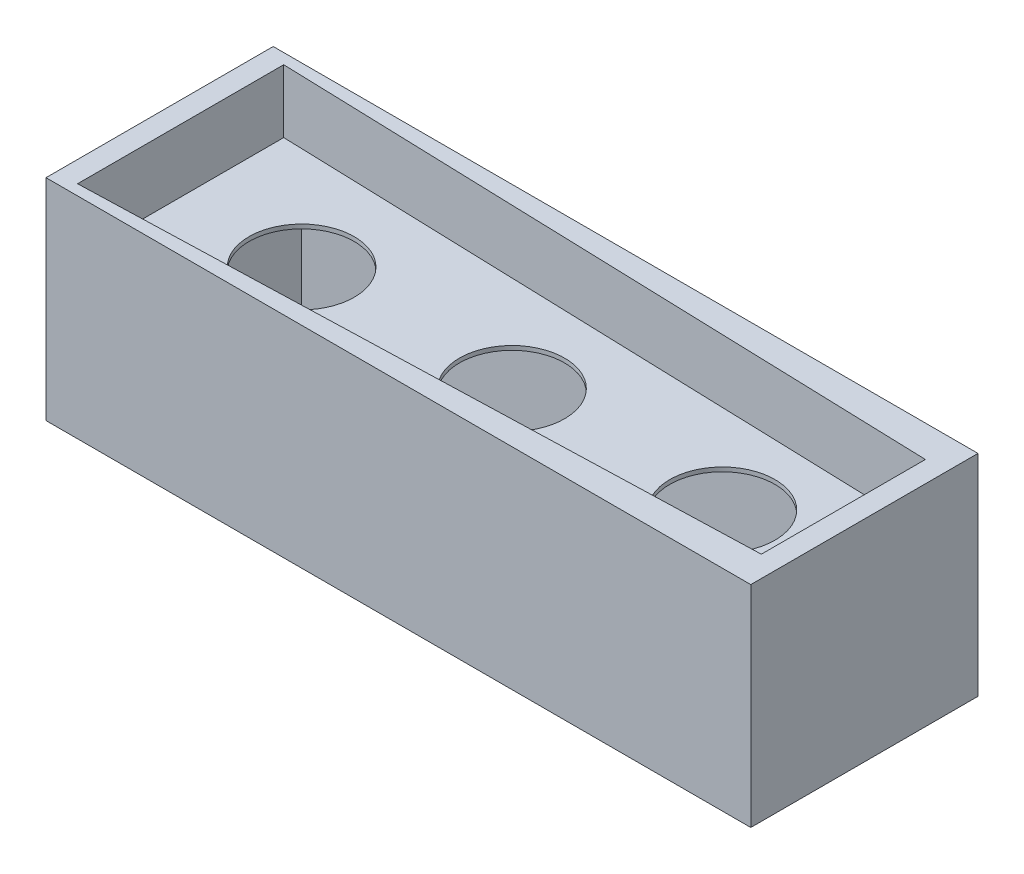
from build123d import *

# Parameters (mm, degrees)
SKETCH2_W           = 335
SKETCH2_H           = 108
BOSS_EXTRUDE4_DEPTH = 100
CUT_EXTRUDE1_DEPTH  = 30
SKETCH4_W           = 300
SKETCH4_H           = 100
CUT_EXTRUDE2_DEPTH  = 68
SKETCH7_R           = 25
CUT_EXTRUDE6_DEPTH  = 61
SKETCH8_R           = 25
CUT_EXTRUDE7_DEPTH  = 61
SKETCH9_R           = 25
CUT_EXTRUDE8_DEPTH  = 62


with BuildPart() as part:
    # Sketch2 → Boss-Extrude4 (new body)
    with BuildSketch(Plane(origin=(0, 0, 0), x_dir=(1, 0, 0), z_dir=(0, 1, 0))):
        Rectangle(SKETCH2_W, SKETCH2_H)
    extrude(amount=-BOSS_EXTRUDE4_DEPTH)

    # Sketch3 → Cut-Extrude1 (cut)
    with BuildSketch(Plane(origin=(0, 0, 0), x_dir=(1, 0, 0), z_dir=(0, 1, 0))):
        Polygon((-157.5, -49), (-157.5, 49), (157.5, 39), (157.5, -39), align=None)
    extrude(amount=-CUT_EXTRUDE1_DEPTH, mode=Mode.SUBTRACT)

    # Sketch4 → Cut-Extrude2 (cut)
    with BuildSketch(Plane(origin=(0, -100, 0), x_dir=(-1, 0, 0), z_dir=(0, -1, 0))):
        Rectangle(SKETCH4_W, SKETCH4_H)
    extrude(amount=-CUT_EXTRUDE2_DEPTH, mode=Mode.SUBTRACT)

    # Sketch7 → Cut-Extrude6 (cut)
    with BuildSketch(Plane(origin=(0, -30, 0), x_dir=(1, 0, 0), z_dir=(0, 1, 0))):
        with Locations((-100, 0)):
            Circle(SKETCH7_R)
    extrude(amount=-CUT_EXTRUDE6_DEPTH, mode=Mode.SUBTRACT)

    # Sketch8 → Cut-Extrude7 (cut)
    with BuildSketch(Plane(origin=(0, -30, 0), x_dir=(1, 0, 0), z_dir=(0, 1, 0))):
        Circle(SKETCH8_R)
    extrude(amount=-CUT_EXTRUDE7_DEPTH, mode=Mode.SUBTRACT)

    # Sketch9 → Cut-Extrude8 (cut)
    with BuildSketch(Plane(origin=(0, -30, 0), x_dir=(1, 0, 0), z_dir=(0, 1, 0))):
        with Locations((100, 0)):
            Circle(SKETCH9_R)
    extrude(amount=-CUT_EXTRUDE8_DEPTH, mode=Mode.SUBTRACT)


solid = part.part
